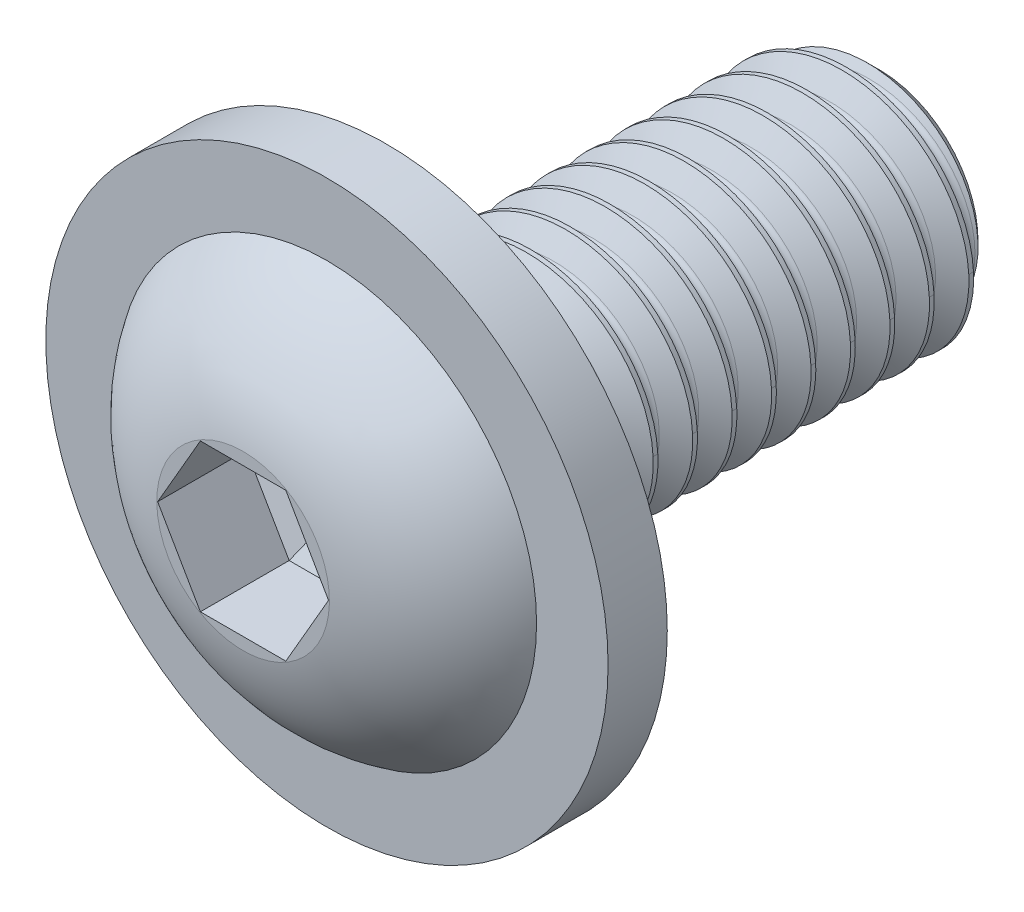
from build123d import *
from OCP.BRepFilletAPI import BRepFilletAPI_MakeChamfer
from build123d.topology import SkipClean

# Parameters (mm, degrees)
SKIZZE1_R                       = 5.7
AUFSATZ_LINEAR_AUSTRAGEN1_DEPTH = 1.2
SCHNITT_LINEAR_AUSTRAGEN1_DEPTH = 2.4
FASE1_SIZE                      = 0.6
FASE1_SIZE2                     = 1.286704152
SKIZZE5_R                       = 2.5
AUFSATZ_LINEAR_AUSTRAGEN2_DEPTH = 10
VERRUNDUNG1_R                   = 0.75
FASE2_SIZE                      = 0.5
SCHNITT_AUSTRAGUNG1_PITCH       = 0.8
AUFSATZ_LINEAR_START            = -10
SKIZZE6_2_R                     = 2.5
AUFSATZ_LINEAR_AUSTRAGEN3_DEPTH = 2


with BuildPart() as part:
    # Skizze1 → Aufsatz-Linear austragen1 (new body)
    with BuildSketch(Plane.XY):
        Circle(SKIZZE1_R)
    extrude(amount=AUFSATZ_LINEAR_AUSTRAGEN1_DEPTH)

    # Skizze2 → Rotation1 (revolve)
    with BuildSketch(Plane(origin=(0, 0, 0), x_dir=(0, 0, -1), z_dir=(1, 0, 0))):
        with BuildLine():
            ThreePointArc((-1.2, 4.25), (-2.312073264, 3.178209819), (-2.9, 1.75))
            Line((-2.9, 1.75), (-2.9, 0))
            Line((-2.9, 0), (-1.2, 0))
            Line((-1.2, 0), (-1.2, 4.25))
        make_face()
    revolve(axis=Axis((0, 0, 1.2), (0, 0, 1)))

    # Skizze4 → Schnitt-Linear austragen1 (cut)
    with BuildSketch(Plane.XY.offset(2.9)):
        Polygon((-0.866025404, -1.5), (0.866025404, -1.5), (1.732050808, 0), (0.866025404, 1.5), (-0.866025404, 1.5), (-1.732050808, 0), align=None)
    extrude(amount=-SCHNITT_LINEAR_AUSTRAGEN1_DEPTH, mode=Mode.SUBTRACT)

    # Fase1: one chamfer whose edges measure the first distance from different faces: ONE call of the kernel's chamfer builder (chamfer() names one face for all edges)
    fase1_edges_1 = [part.edges().sort_by_distance(p)[0] for p in [
        (-1.299038106, -0.75, 0.5),
    ]]
    fase1_side_1 = [part.faces().sort_by_distance(p)[0] for p in [
        (-1.299038106, -0.75, 1.7),
    ]]
    fase1_edges_2 = [part.edges().sort_by_distance(p)[0] for p in [
        (-1.299038106, 0.75, 0.5),
    ]]
    fase1_side_2 = [part.faces().sort_by_distance(p)[0] for p in [
        (-1.299038106, 0.75, 1.7),
    ]]
    fase1_edges_3 = [part.edges().sort_by_distance(p)[0] for p in [
        (0, 1.5, 0.5),
    ]]
    fase1_side_3 = [part.faces().sort_by_distance(p)[0] for p in [
        (0, 1.5, 1.7),
    ]]
    fase1_edges_4 = [part.edges().sort_by_distance(p)[0] for p in [
        (1.299038106, 0.75, 0.5),
    ]]
    fase1_side_4 = [part.faces().sort_by_distance(p)[0] for p in [
        (1.299038106, 0.75, 1.7),
    ]]
    fase1_edges_5 = [part.edges().sort_by_distance(p)[0] for p in [
        (1.299038106, -0.75, 0.5),
    ]]
    fase1_side_5 = [part.faces().sort_by_distance(p)[0] for p in [
        (1.299038106, -0.75, 1.7),
    ]]
    fase1_edges_6 = [part.edges().sort_by_distance(p)[0] for p in [
        (0, -1.5, 0.5),
    ]]
    fase1_side_6 = [part.faces().sort_by_distance(p)[0] for p in [
        (0, -1.5, 1.7),
    ]]
    fase1 = BRepFilletAPI_MakeChamfer(part.part.solid().wrapped)
    for e in fase1_edges_1:
        fase1.Add(FASE1_SIZE, FASE1_SIZE2, e.wrapped, fase1_side_1[0].wrapped)  # the first distance lies on this face
    for e in fase1_edges_2:
        fase1.Add(FASE1_SIZE, FASE1_SIZE2, e.wrapped, fase1_side_2[0].wrapped)  # the first distance lies on this face
    for e in fase1_edges_3:
        fase1.Add(FASE1_SIZE, FASE1_SIZE2, e.wrapped, fase1_side_3[0].wrapped)  # the first distance lies on this face
    for e in fase1_edges_4:
        fase1.Add(FASE1_SIZE, FASE1_SIZE2, e.wrapped, fase1_side_4[0].wrapped)  # the first distance lies on this face
    for e in fase1_edges_5:
        fase1.Add(FASE1_SIZE, FASE1_SIZE2, e.wrapped, fase1_side_5[0].wrapped)  # the first distance lies on this face
    for e in fase1_edges_6:
        fase1.Add(FASE1_SIZE, FASE1_SIZE2, e.wrapped, fase1_side_6[0].wrapped)  # the first distance lies on this face
    add(Compound.cast(fase1.Shape()), mode=Mode.REPLACE)

    # Skizze5 → Aufsatz-Linear austragen2 (add)
    with BuildSketch(Plane(origin=(0, 0, 0), x_dir=(-1, 0, 0), z_dir=(0, 0, -1))):
        Circle(SKIZZE5_R)
    extrude(amount=AUFSATZ_LINEAR_AUSTRAGEN2_DEPTH)

    # Verrundung1
    verrundung1_edges = [part.edges().sort_by_distance(p)[0] for p in [
        (2.5, 0, 0),
    ]]
    fillet(verrundung1_edges, radius=VERRUNDUNG1_R)

    # Fase2
    fase2_edges = [part.edges().sort_by_distance(p)[0] for p in [
        (2.5, 0, -10),
    ]]
    chamfer(fase2_edges, length=FASE2_SIZE)

    # Schnitt-Austragung1: the profile of Skizze7 profile screwed along a right-hand helix of 11.25 turns, 8 arcs to a turn; built about Z, then put on its axis
    schnitt_austragung1_z = Axis((0, 0, 0), (0, 0, 1))
    schnitt_austragung1_corners = [(2.5003, 0, 0.192356869), (2.07, 0, -0.056076952), (2.01, 0, -0.16), (2.07, 0, -0.263923048), (2.5003, 0, -0.512356869)]
    with BuildLine(mode=Mode.PRIVATE) as schnitt_austragung1_profile:
        Line(schnitt_austragung1_corners[0], schnitt_austragung1_corners[1])
        Line(schnitt_austragung1_corners[3], schnitt_austragung1_corners[4])
        Line(schnitt_austragung1_corners[4], schnitt_austragung1_corners[0])
        ThreePointArc((2.07, 0, -0.056076952), (2.026076952, 0, -0.1), (2.01, 0, -0.16))
        ThreePointArc((2.01, 0, -0.16), (2.026076952, 0, -0.22), (2.07, 0, -0.263923048))
    schnitt_austragung1_cap = Face(schnitt_austragung1_profile.wire())
    schnitt_austragung1_arcs = [((2.07, 0, -0.056076952), (2.01, 0, -0.090717968), (2.01, 0, -0.16), (1, 0.8660254037844686, 1)), ((2.01, 0, -0.16), (2.01, 0, -0.229282032), (2.07, 0, -0.263923048), (1, 0.8660254037844686, 1))]  # start, shoulder, end, weights
    schnitt_austragung1_turn_angles = [0, 22.5, 45, 67.5, 90, 112.5, 135, 157.5, 180, 202.5, 225, 247.5, 270, 292.5, 315, 337.5, 360]
    schnitt_austragung1_turn_weights = [1, 0.9238795325112867, 1, 0.9238795325112867, 1, 0.9238795325112867, 1, 0.9238795325112867, 1, 0.9238795325112867, 1, 0.9238795325112867, 1, 0.9238795325112867, 1, 0.9238795325112867, 1]
    schnitt_austragung1_turn_rails = [Edge.make_bspline([Vector(p[0], p[1], 0).rotate(schnitt_austragung1_z, schnitt_austragung1_turn_angles[k]) / schnitt_austragung1_turn_weights[k] + Vector(0, 0, p[2] + SCHNITT_AUSTRAGUNG1_PITCH * schnitt_austragung1_turn_angles[k] / 360) for k in range(17)], [0, 0, 0, 1, 1, 2, 2, 3, 3, 4, 4, 5, 5, 6, 6, 7, 7, 8, 8, 8], 2, schnitt_austragung1_turn_weights) for p in schnitt_austragung1_corners]
    schnitt_austragung1_turn_sides = [*[Face.make_surface_from_curves(schnitt_austragung1_turn_rails[p[0]], schnitt_austragung1_turn_rails[p[1]]) for p in [(0, 1), (3, 4), (4, 0)]], *[Face.make_bezier_surface([[Vector(p[j][0], p[j][1], 0).rotate(schnitt_austragung1_z, schnitt_austragung1_turn_angles[2 * i + k]) / schnitt_austragung1_turn_weights[2 * i + k] + Vector(0, 0, p[j][2] + SCHNITT_AUSTRAGUNG1_PITCH * schnitt_austragung1_turn_angles[2 * i + k] / 360) for k in range(3)] for j in range(3)], [[p[3][j] * schnitt_austragung1_turn_weights[2 * i + k] for k in range(3)] for j in range(3)]) for p in schnitt_austragung1_arcs for i in range(8)]]
    schnitt_austragung1_last_angles = [3960, 3982.5, 4005, 4027.5, 4050]
    schnitt_austragung1_last_weights = [1, 0.9238795325112867, 1, 0.9238795325113217, 1]
    schnitt_austragung1_last_rails = [Edge.make_bspline([Vector(p[0], p[1], 0).rotate(schnitt_austragung1_z, schnitt_austragung1_last_angles[k]) / schnitt_austragung1_last_weights[k] + Vector(0, 0, p[2] + SCHNITT_AUSTRAGUNG1_PITCH * schnitt_austragung1_last_angles[k] / 360) for k in range(5)], [0, 0, 0, 1, 1, 2, 2, 2], 2, schnitt_austragung1_last_weights) for p in schnitt_austragung1_corners]
    schnitt_austragung1_last_sides = [*[Face.make_surface_from_curves(schnitt_austragung1_last_rails[p[0]], schnitt_austragung1_last_rails[p[1]]) for p in [(0, 1), (3, 4), (4, 0)]], *[Face.make_bezier_surface([[Vector(p[j][0], p[j][1], 0).rotate(schnitt_austragung1_z, schnitt_austragung1_last_angles[2 * i + k]) / schnitt_austragung1_last_weights[2 * i + k] + Vector(0, 0, p[j][2] + SCHNITT_AUSTRAGUNG1_PITCH * schnitt_austragung1_last_angles[2 * i + k] / 360) for k in range(3)] for j in range(3)], [[p[3][j] * schnitt_austragung1_last_weights[2 * i + k] for k in range(3)] for j in range(3)]) for p in schnitt_austragung1_arcs for i in range(2)]]
    schnitt_austragung1 = Plane(origin=(0, 0, -10), x_dir=(-1, 0, 0), z_dir=(0, 0, 1)) * Solid(Shell([*[p.moved(Location((0, 0, SCHNITT_AUSTRAGUNG1_PITCH * i))) for i in range(11) for p in schnitt_austragung1_turn_sides], *schnitt_austragung1_last_sides, schnitt_austragung1_cap, schnitt_austragung1_cap.rotate(schnitt_austragung1_z, 4050).moved(Location((0, 0, SCHNITT_AUSTRAGUNG1_PITCH * 4050 / 360)))]))
    add(schnitt_austragung1, mode=Mode.SUBTRACT)

    # Skizze6<2> → Aufsatz-Linear austragen3 (add)
    with SkipClean():  # the faces are left unmerged after this step: merging them gives an invalid solid
        with BuildSketch(Plane(origin=(0, 0, -10), x_dir=(-1, 0, 0), z_dir=(0, 0, -1)).offset(AUFSATZ_LINEAR_START)):
            with Locations(Location((0, 0, 0), (0, 0, 180))):
                Circle(SKIZZE6_2_R)
        extrude(amount=AUFSATZ_LINEAR_AUSTRAGEN3_DEPTH)


solid = part.part
